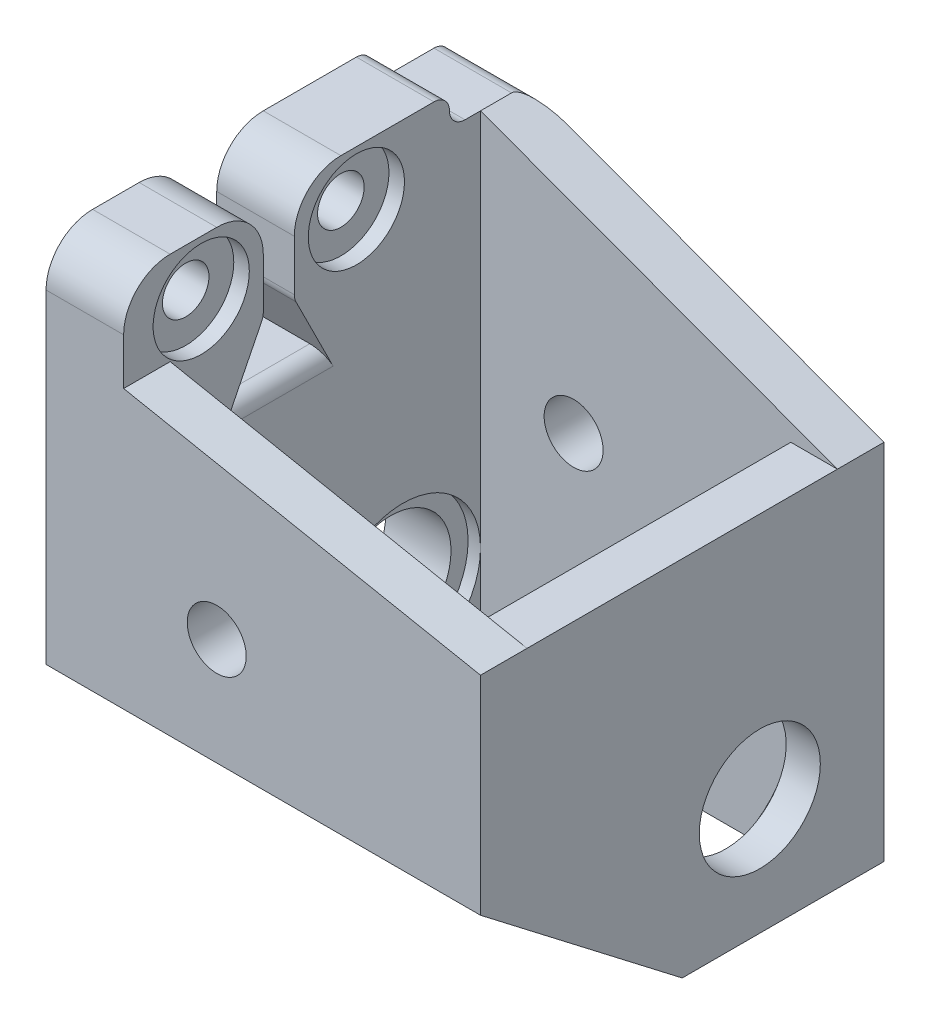
from build123d import *
from build123d.topology import SkipClean

# Parameters (mm, degrees)
SKETCH_1_W           = 20
SKETCH_1_H           = 57.76596942167697
EXTRUDE_1_DEPTH      = 3
EXTRUDE_2_DEPTH      = 3
CUT_EXTRUDE_1_DEPTH  = 6
SKETCH_8_R           = 4.48
CUT_EXTRUDE_2_DEPTH  = 0.8
SKETCH_9_R           = 1.9
CUT_EXTRUDE_3_DEPTH  = 3.8
SKETCH_12_W          = 26.000000000000007
SKETCH_12_H          = 35.36596942167698
CUT_EXTRUDE_4_DEPTH  = 36.00000000000001
CUT_EXTRUDE_8_DEPTH  = 28.00000000000001
SKETCH_23_W          = 26.000000000000004
SKETCH_23_H          = 26
SKETCH_23_W_2        = 20
SKETCH_23_H_2        = 19.999999999999993
EXTRUDE_7_DEPTH      = 4
SKETCH_24_W          = 20
SKETCH_24_H          = 19.999999999999993
EXTRUDE_8_DEPTH      = 3
SKETCH_25_W          = 5.000000000000002
SKETCH_25_H          = 16
SKETCH_25_R          = 1.4999999999999991
EXTRUDE_9_DEPTH      = 3
FILLET_1_R           = 1
CUT_EXTRUDE_9_DEPTH  = 3
SKETCH_27_R          = 1.4999999999999987
CUT_EXTRUDE_10_DEPTH = 3
SKETCH_28_W          = 20
SKETCH_28_H          = 19.999999999999993
CUT_EXTRUDE_11_DEPTH = 10
CUT_EXTRUDE_12_DEPTH = 42.00000000000001
SKETCH_31_R          = 4.48
SKETCH_31_R_2        = 3.98
EXTRUDE_13_DEPTH     = 0.8
SKETCH_32_R          = 5.000000000000001
SKETCH_32_R_2        = 3.98
CUT_EXTRUDE_13_DEPTH = 0.8
SKETCH_33_R          = 4.48
EXTRUDE_14_DEPTH     = 3
SKETCH_36_R          = 5.000000000000001
CUT_EXTRUDE_14_DEPTH = 3
SKETCH_37_R          = 3.98
SKETCH_37_R_2        = 3.900000000000001
EXTRUDE_17_DEPTH     = 0.8
SKETCH_38_R          = 1.5000000000000009
EXTRUDE_18_DEPTH     = 3
SKETCH_39_W          = 4.187599959799879
SKETCH_39_H          = 1.3608825238343043
EXTRUDE_19_DEPTH     = 3
EXTRUDE_START        = 2
SKETCH_43_R          = 1.5000000000000024
SKETCH_43_R_2        = 1.5000000000000009
SKETCH_43_R_3        = 3.900000000000002
EXTRUDE_22_DEPTH     = 2
SKETCH_44_W          = 5
SKETCH_44_H          = 9.399224841629362
EXTRUDE_23_DEPTH     = 2
EXTRUDE_24_DEPTH     = 3
SKETCH_47_W          = 5
SKETCH_47_H          = 9.399224841629362
EXTRUDE_25_DEPTH     = 8
SKETCH_51_W          = 5
SKETCH_51_H          = 14
SKETCH_51_H_2        = 7.999999999999998
EXTRUDE_28_DEPTH     = 1.1
CUT_EXTRUDE_16_DEPTH = 6.1000000000000005
FILLET_START         = -16
FILLET_9_DEPTH       = 7
FILLET_START_2       = -15
FILLET_9_2_DEPTH     = 5
EXTRUDE_30_DEPTH     = 3
FILLET_10_R          = 1
SKETCH_57_W          = 5
SKETCH_57_H          = 10.499224841629362
EXTRUDE_31_DEPTH     = 1
SKETCH_58_W          = 5
SKETCH_58_H          = 10.499224841629362
EXTRUDE_32_DEPTH     = 1
FILLET_11_R          = 3
CUT_EXTRUDE_19_DEPTH = 6.500000000000001
FILLET_14_R          = 1
FILLET_19_R          = 1
SKETCH_62_R          = 3.1000000000000005
CUT_EXTRUDE_20_DEPTH = 1


with BuildPart() as part:
    # 草图1 → 凸台-拉伸1 (new body)
    with BuildSketch(Plane.XY):
        with Locations((0, -28.882984710838485)):
            Rectangle(SKETCH_1_W, SKETCH_1_H)
    extrude_1 = extrude(amount=-EXTRUDE_1_DEPTH)

    # 草图2 → 凸台-拉伸2 (add)
    with BuildSketch(Plane.ZY.offset(10)):
        Polygon((-3, -1.22e-15), (23, 0), (23.000000000000007, -57.76596942167697), (-3, -57.76596942167697), align=None)
    extrude_2 = extrude(amount=EXTRUDE_2_DEPTH)

    # 草图7 → 切除-拉伸1 (cut)
    with BuildSketch(Plane(origin=(-10, 0, 0), x_dir=(0, 0, -1), z_dir=(1, 0, 0))):
        with BuildLine():
            ThreePointArc((-1.0999999999999996, -14.899999999999997), (-5, -10.999999999999996), (-8.9, -14.899999999999997))
            Line((-8.9, -14.899999999999997), (-1.1000000000000014, -14.899999999999997))
        make_face()
        with BuildLine():
            Line((-1.1000000000000014, -14.899999999999997), (-8.9, -14.899999999999997))
            ThreePointArc((-8.9, -14.899999999999997), (-5.000000000000001, -18.799999999999997), (-1.0999999999999996, -14.899999999999999))
        make_face()
    cut_extrude_1 = extrude(amount=-CUT_EXTRUDE_1_DEPTH, mode=Mode.SUBTRACT)

    # 草图8 → 切除-拉伸2 (cut)
    with BuildSketch(Plane.ZY.offset(13.000000000000002)):
        with Locations((5, -14.899999999999997)):
            Circle(SKETCH_8_R)
    cut_extrude_2 = extrude(amount=-CUT_EXTRUDE_2_DEPTH, mode=Mode.SUBTRACT)

    # 草图9 → 切除-拉伸3 (cut)
    with BuildSketch(Plane.XY):
        with Locations((-4, -5.499999999999998)):
            Circle(SKETCH_9_R)
    cut_extrude_3 = extrude(amount=-CUT_EXTRUDE_3_DEPTH, mode=Mode.SUBTRACT)

    # 镜向1: 凸台-拉伸2 across plane
    add(extrude_2.mirror(Plane(origin=(0, 0, 0), x_dir=(0, 0, 1), z_dir=(1, 0, 0))))

    # 镜向2: 切除-拉伸1, 切除-拉伸2 across plane
    add(cut_extrude_1.mirror(Plane(origin=(0, 0, 0), x_dir=(0, 0, 1), z_dir=(1, 0, 0))), mode=Mode.SUBTRACT)
    add(cut_extrude_2.mirror(Plane(origin=(0, 0, 0), x_dir=(0, 0, 1), z_dir=(1, 0, 0))), mode=Mode.SUBTRACT)

    # 镜向3: 凸台-拉伸1 across plane
    add(extrude_1.mirror(Plane.XY.offset(10)))

    # 镜向5: 切除-拉伸3 across plane
    add(cut_extrude_3.mirror(Plane.XY.offset(10)), mode=Mode.SUBTRACT)

    # 草图12 → 切除-拉伸4 (cut)
    with BuildSketch(Plane(origin=(13.000000000000002, 0, 0), x_dir=(0, 0, -1), z_dir=(1, 0, 0))):
        with Locations((-10.000000000000004, -40.08298471083848)):
            Rectangle(SKETCH_12_W, SKETCH_12_H)
    extrude(amount=-CUT_EXTRUDE_4_DEPTH, mode=Mode.SUBTRACT)

    # 草图22 → 切除-拉伸8 (cut)
    with BuildSketch(Plane(origin=(13.000000000000002, 0, 0), x_dir=(0, 0, -1), z_dir=(1, 0, 0))):
        Polygon((-23.000000000000007, -12.399999999999997), (-23.000000000000007, -22.399999999999995), (-10.000000000000007, -22.399999999999995), align=None)
    extrude(amount=-CUT_EXTRUDE_8_DEPTH, mode=Mode.SUBTRACT)

    # 草图23 → 凸台-拉伸7 (add)
    with BuildSketch(Plane(origin=(0, 0, 0), x_dir=(1, 0, 0), z_dir=(0, 1, 0))):
        with Locations((0, -10)):
            Rectangle(SKETCH_23_W, SKETCH_23_H)
        with Locations((0, -9.999999999999996)):
            Rectangle(SKETCH_23_W_2, SKETCH_23_H_2, mode=Mode.SUBTRACT)
    extrude(amount=EXTRUDE_7_DEPTH)

    # 草图24 → 凸台-拉伸8 (add)
    with BuildSketch(Plane(origin=(0, 4, 0), x_dir=(1, 0, 0), z_dir=(0, 1, 0))):
        with Locations((0, -9.999999999999996)):
            Rectangle(SKETCH_24_W, SKETCH_24_H)
    extrude(amount=-EXTRUDE_8_DEPTH)

    # 草图25 → 凸台-拉伸9 (add)
    with BuildSketch(Plane(origin=(0, 4, 0), x_dir=(1, 0, 0), z_dir=(0, 1, 0))):
        with Locations((15.500000000000004, -15)):
            Rectangle(SKETCH_25_W, SKETCH_25_H)
        with Locations(Location((15.500000000000002, -20.23329325648959, 0), (0, 0, 270))):
            Circle(SKETCH_25_R, mode=Mode.SUBTRACT)
        with Locations(Location((15.500000000000002, -10.23329325648959, 0), (0, 0, 270))):
            Circle(SKETCH_25_R, mode=Mode.SUBTRACT)
    extrude(amount=-EXTRUDE_9_DEPTH)

    # 圆角1
    fillet_1_edges = [part.edges().sort_by_distance(p)[0] for p in [
        (18.000000000000004, 1, 15),
    ]]
    fillet(fillet_1_edges, radius=FILLET_1_R)

    # 草图26 → 切除-拉伸9 (cut)
    with BuildSketch(Plane(origin=(13.000000000000002, 0, 0), x_dir=(0, 0, -1), z_dir=(1, 0, 0))):
        with BuildLine():
            Line((-16, 1.0000000000000004), (-13.999999999999998, 1.0000000000000004))
            ThreePointArc((-13.999999999999998, 1.0000000000000004), (-15, 0), (-16, 1.0000000000000004))
        make_face()
    extrude(amount=-CUT_EXTRUDE_9_DEPTH, mode=Mode.SUBTRACT)

    # 草图27 → 切除-拉伸10 (cut)
    with BuildSketch(Plane(origin=(0, 4, 0), x_dir=(1, 0, 0), z_dir=(0, 1, 0))):
        with Locations(Location((7.500000000000002, -15.233293256489592, 0), (0, 0, 270))):
            Circle(SKETCH_27_R)
    extrude(amount=-CUT_EXTRUDE_10_DEPTH, mode=Mode.SUBTRACT)

    # 草图28 → 切除-拉伸11 (cut)
    with BuildSketch(Plane.XZ.offset(-1)):
        with Locations((0, 9.999999999999996)):
            Rectangle(SKETCH_28_W, SKETCH_28_H)
    extrude(amount=-CUT_EXTRUDE_11_DEPTH, mode=Mode.SUBTRACT)

    # 草图29 → 切除-拉伸12 (cut)
    with BuildSketch(Plane(origin=(0, 0, -3), x_dir=(-1, 0, 0), z_dir=(0, 0, -1))):
        Polygon((13.000000000000002, 4), (-24.68163228941081, 4), (-24.68163228941081, 0.9999999999999957), (13.000000000000002, 1.0000000000000002), align=None)
    extrude(amount=-CUT_EXTRUDE_12_DEPTH, mode=Mode.SUBTRACT)

    # 草图31 → 凸台-拉伸13 (add)
    with BuildSketch(Plane.ZY.offset(12.200000000000001)):
        with Locations((5, -14.899999999999997)):
            Circle(SKETCH_31_R)
        with Locations((5, -14.899999999999997)):
            Circle(SKETCH_31_R_2, mode=Mode.SUBTRACT)
    extrude(amount=EXTRUDE_13_DEPTH)

    # 草图32 → 切除-拉伸13 (cut)
    with BuildSketch(Plane(origin=(-10, 0, 0), x_dir=(0, 0, -1), z_dir=(1, 0, 0))):
        with Locations((-5, -14.899999999999997)):
            Circle(SKETCH_32_R)
        with Locations(Location((-5, -14.899999999999997, 0), (0, 0, 180))):
            Circle(SKETCH_32_R_2, mode=Mode.SUBTRACT)
    cut_extrude_13 = extrude(amount=-CUT_EXTRUDE_13_DEPTH, mode=Mode.SUBTRACT)

    # 草图33 → 凸台-拉伸14 (add)
    with BuildSketch(Plane(origin=(13.000000000000002, 0, 0), x_dir=(0, 0, -1), z_dir=(1, 0, 0))):
        with Locations((-5, -14.899999999999997)):
            Circle(SKETCH_33_R)
    extrude(amount=-EXTRUDE_14_DEPTH)

    # 镜向6: 切除-拉伸1, 切除-拉伸13 across plane
    add(cut_extrude_1.mirror(Plane(origin=(0, 0, 0), x_dir=(0, 0, 1), z_dir=(1, 0, 0))), mode=Mode.SUBTRACT)
    add(cut_extrude_13.mirror(Plane(origin=(0, 0, 0), x_dir=(0, 0, 1), z_dir=(1, 0, 0))), mode=Mode.SUBTRACT)

    # 草图36 → 切除-拉伸14 (cut)
    with BuildSketch(Plane(origin=(-10.8, 0, 0), x_dir=(0, 0, -1), z_dir=(1, 0, 0))):
        with Locations((-5, -14.899999999999997)):
            Circle(SKETCH_36_R)
    cut_extrude_14 = extrude(amount=CUT_EXTRUDE_14_DEPTH, mode=Mode.SUBTRACT)

    # 镜向7: 切除-拉伸14 across plane
    add(cut_extrude_14.mirror(Plane(origin=(0, 0, 0), x_dir=(0, 0, 1), z_dir=(1, 0, 0))), mode=Mode.SUBTRACT)

    # 草图37 → 凸台-拉伸17 (add)
    with SkipClean():  # the faces are left unmerged after this step: merging them gives an invalid solid
        with BuildSketch(Plane.ZY.offset(12.200000000000001)):
            with Locations((5, -14.899999999999997)):
                Circle(SKETCH_37_R)
            with Locations((5, -14.899999999999997)):
                Circle(SKETCH_37_R_2, mode=Mode.SUBTRACT)
        extrude(amount=EXTRUDE_17_DEPTH)

    # 草图38 → 凸台-拉伸18 (add)
    # profile 1 of 2: a face of its own
    with SkipClean():  # the faces are left unmerged after this step: merging them gives an invalid solid
        with BuildSketch(Plane.ZY.offset(13.000000000000002)):
            Polygon((15, 10.399224841629362), (15, 1), (20.999999999999996, 1.0000000000000002), (20.999999999999996, 10.399224841629362), align=None)
            with Locations((18, 8)):
                Circle(SKETCH_38_R, mode=Mode.SUBTRACT)
        # profile 2 of 2: a face of its own
        with BuildSketch(Plane.ZY.offset(13.000000000000002)):
            Polygon((11, 1), (11, 10.399224841629362), (5.000000000000001, 10.399224841629362), (5.000000000000001, 1.0000000000000002), align=None)
            with Locations((8, 8)):
                Circle(SKETCH_38_R, mode=Mode.SUBTRACT)
        extrude(amount=-EXTRUDE_18_DEPTH)

    # 草图39 → 凸台-拉伸19 (add)
    with SkipClean():  # the faces are left unmerged after this step: merging them gives an invalid solid
        with BuildSketch(Plane(origin=(13.000000000000002, 0, 0), x_dir=(0, 0, -1), z_dir=(1, 0, 0))):
            with Locations((-15.28799119011226, 0.3195587380828476)):
                Rectangle(SKETCH_39_W, SKETCH_39_H)
        extrude(amount=-EXTRUDE_19_DEPTH)

    # 草图43 → 凸台-拉伸22 (add)
    with BuildSketch(Plane.ZY.offset(13.000000000000002).offset(EXTRUDE_START)):
        Polygon((-3, 1.0000000000000002), (5.000000000000004, 1.0000000000000002), (5.000000000000001, 10.399224841629362), (11, 10.399224841629362), (11, 1.0000000000000002), (15, 1.0000000000000002), (15, 10.399224841629362), (20.999999999999996, 10.399224841629362), (20.999999999999996, 1.0000000000000002), (23.000000000000007, 1.0000000000000002), (23.000000000000007, -12.399999999999997), (10.000000000000009, -22.399999999999995), (-3, -22.399999999999995), align=None)
        with Locations((8, 8)):
            Circle(SKETCH_43_R, mode=Mode.SUBTRACT)
        with Locations((18, 8)):
            Circle(SKETCH_43_R_2, mode=Mode.SUBTRACT)
        with Locations((5, -14.899999999999997)):
            Circle(SKETCH_43_R_3, mode=Mode.SUBTRACT)
    extrude(amount=-EXTRUDE_22_DEPTH)

    # 草图44 → 凸台-拉伸23 (add)
    with BuildSketch(Plane.XY.offset(20.999999999999996)):
        with Locations((-12.500000000000002, 5.699612420814681)):
            Rectangle(SKETCH_44_W, SKETCH_44_H)
    extrude(amount=EXTRUDE_23_DEPTH)

    # 草图45 → 凸台-拉伸24 (add)
    with BuildSketch(Plane.XY.offset(23)):
        Polygon((-10.000000000000002, 0.9999999999999981), (13.000000000000002, 0.9999999999999943), (-10.000000000000002, 5.499999999999998), align=None)
    extrude(amount=-EXTRUDE_24_DEPTH)

    # 草图47 → 凸台-拉伸25 (add)
    with BuildSketch(Plane(origin=(0, 0, 5.000000000000001), x_dir=(-1, 0, 0), z_dir=(0, 0, -1))):
        with Locations((12.500000000000002, 5.699612420814681)):
            Rectangle(SKETCH_47_W, SKETCH_47_H)
    extrude(amount=EXTRUDE_25_DEPTH)

    # 草图51 → 凸台-拉伸28 (add)
    with BuildSketch(Plane(origin=(0, 10.399224841629362, 0), x_dir=(1, 0, 0), z_dir=(0, 1, 0))):
        with Locations((-12.500000000000002, -4)):
            Rectangle(SKETCH_51_W, SKETCH_51_H)
        with Locations((-12.500000000000002, -19)):
            Rectangle(SKETCH_51_W, SKETCH_51_H_2)
    extrude(amount=EXTRUDE_28_DEPTH)

    # 草图53 → 切除-拉伸16 (cut)
    with BuildSketch(Plane(origin=(-10, 0, 0), x_dir=(0, 0, -1), z_dir=(1, 0, 0))):
        Polygon((2.999999999999999, 11.499224841629362), (-2.000000000000001, 11.499224841629362), (-2.0000000000000004, 9.49922484162936), (2.999999999999999, 9.499224841629362), align=None)
    extrude(amount=-CUT_EXTRUDE_16_DEPTH, mode=Mode.SUBTRACT)

    # 圆角9: read off the stored shape, not the designer's step
    # 圆角9 outline → 圆角9 (cut)
    with BuildSketch(Plane.YZ.offset(FILLET_START)):
        with BuildLine():
            Line((11.499224842, 2), (11.499224842, 3))
            ThreePointArc((11.499224842, 3), (11.206331623, 2.292893219), (10.499224842, 2))
            Line((10.499224842, 2), (11.499224842, 2))
        make_face()
    extrude(amount=FILLET_9_DEPTH, mode=Mode.SUBTRACT)

    # Fillet 9 2 outline → Fillet 9 2 (add)
    with BuildSketch(Plane.YZ.offset(FILLET_START_2)):
        with BuildLine():
            ThreePointArc((9.499224842, 1), (9.79211806, 1.707106782), (10.499224842, 2))
            Line((10.499224842, 2), (9.499224842, 2))
            Line((9.499224842, 2), (9.499224842, 1))
        make_face()
    extrude(amount=FILLET_9_2_DEPTH)

    # 草图54 → 凸台-拉伸30 (add)
    with BuildSketch(Plane(origin=(0, 0, -3), x_dir=(-1, 0, 0), z_dir=(0, 0, -1))):
        Polygon((-13.000000000000002, 0.9999999999999972), (10.000000000000002, 1.0000000000000002), (10, 9.499224841629362), align=None)
    extrude(amount=-EXTRUDE_30_DEPTH)

    # 圆角10
    fillet_10_edges = [part.edges().sort_by_distance(p)[0] for p in [
        (-12.5, 9.499224841629362, -2.999999999999999),
    ]]
    fillet(fillet_10_edges, radius=FILLET_10_R)

    # 草图57 → 凸台-拉伸31 (add)
    with BuildSketch(Plane(origin=(0, 0, 15), x_dir=(-1, 0, 0), z_dir=(0, 0, -1))):
        with Locations((12.500000000000002, 6.249612420814681)):
            Rectangle(SKETCH_57_W, SKETCH_57_H)
    extrude(amount=EXTRUDE_31_DEPTH)

    # 草图58 → 凸台-拉伸32 (add)
    with BuildSketch(Plane.XY.offset(11)):
        with Locations((-12.500000000000002, 6.249612420814681)):
            Rectangle(SKETCH_58_W, SKETCH_58_H)
    extrude(amount=EXTRUDE_32_DEPTH)

    # 圆角11
    # the kernel refuses this fillet: 3 mm, written as the material it takes off along each edge
    with BuildSketch(Plane(origin=(-2.5000000000000018, 11.499224841629362, 23), x_dir=(0, -1, 0), z_dir=(-1, 0, 0)), Plane(origin=(-2.5000000000000018, 11.499224841629362, 14), x_dir=(0, 0, 1), z_dir=(-1, 0, 0))) as fillet_11_piece_1:
        with BuildLine():
            CenterArc((FILLET_11_R, -FILLET_11_R), FILLET_11_R, 90, 90)
            Line((0, -FILLET_11_R), (0, 0))
            Line((0, 0), (FILLET_11_R, 0))
        make_face()
    extrude(amount=20, mode=Mode.SUBTRACT)
    with BuildSketch(Plane(origin=(-22.5, 11.499224841629362, 12), x_dir=(0, -1, 0), z_dir=(1, 0, 0))) as fillet_11_piece_2:
        with BuildLine():
            CenterArc((FILLET_11_R, FILLET_11_R), FILLET_11_R, 180, 90)
            Line((0, FILLET_11_R), (0, 0))
            Line((0, 0), (FILLET_11_R, 0))
        make_face()
    extrude(amount=20, mode=Mode.SUBTRACT)

    # 草图61 → 切除-拉伸19 (cut)
    with BuildSketch(Plane(origin=(-10, 0, 0), x_dir=(0, 0, -1), z_dir=(1, 0, 0))):
        Polygon((-12, 1.0000000000000002), (-12, 5), (-10, 1.0000000000000007), align=None)
        Polygon((-13.999999999999998, 1.0000000000000002), (-13.999999999999998, 5), (-16, 0.9999999999999998), align=None)
    extrude(amount=-CUT_EXTRUDE_19_DEPTH, mode=Mode.SUBTRACT)

    # 圆角14
    fillet_14_edges = [part.edges().sort_by_distance(p)[0] for p in [
        (-10, 1.0000000000000002, 13),
    ]]
    fillet(fillet_14_edges, radius=FILLET_14_R)

    # 圆角19
    fillet_19_edges = [part.edges().sort_by_distance(p)[0] for p in [
        (-12.5, 5, 12),
        (-12.5, 5, 13.999999999999998),
    ]]
    fillet(fillet_19_edges, radius=FILLET_19_R)

    # 草图62 → 切除-拉伸20 (cut)
    with BuildSketch(Plane(origin=(-10, 0, 0), x_dir=(0, 0, -1), z_dir=(1, 0, 0))):
        with Locations((-18, 8)):
            Circle(SKETCH_62_R)
        with Locations((-8, 8)):
            Circle(SKETCH_62_R)
    extrude(amount=-CUT_EXTRUDE_20_DEPTH, mode=Mode.SUBTRACT)


solid = part.part
